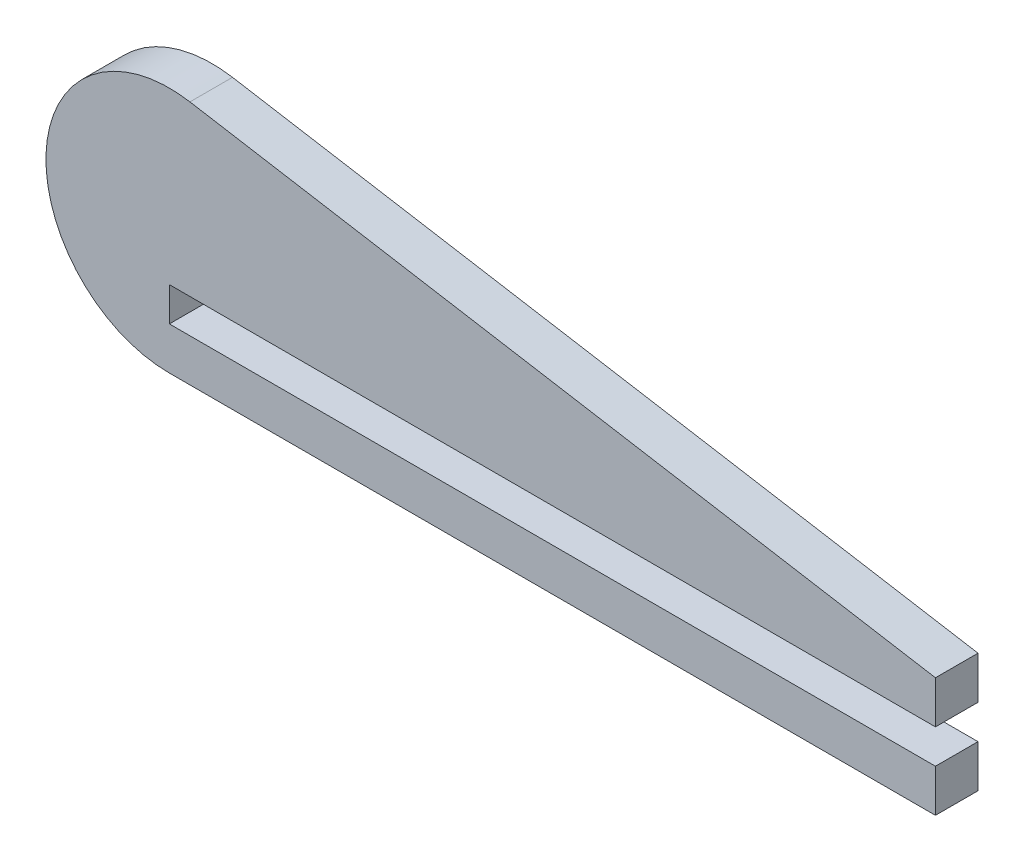
from build123d import *

# Parameters (mm, degrees)
SALIENTE_EXTRUIR1_DEPTH = 2


with BuildPart() as part:
    # Croquis1 → Saliente-Extruir1 (new body)
    with BuildSketch(Plane.XY):
        with BuildLine():
            Line((36, 0), (0, 0))
            Line((0, 0), (0, -1.6))
            Line((0, -1.6), (36, -1.6))
            Line((36, -1.6), (36, -3.6))
            Line((36, -3.6), (0, -3.6))
            ThreePointArc((0, -3.6), (-5.779702788, 2.684804787), (0.966216407, 7.918953213))
            Line((0.966216407, 7.918953213), (36, 2))
            Line((36, 2), (36, 0))
        make_face()
    extrude(amount=SALIENTE_EXTRUIR1_DEPTH)


solid = part.part
